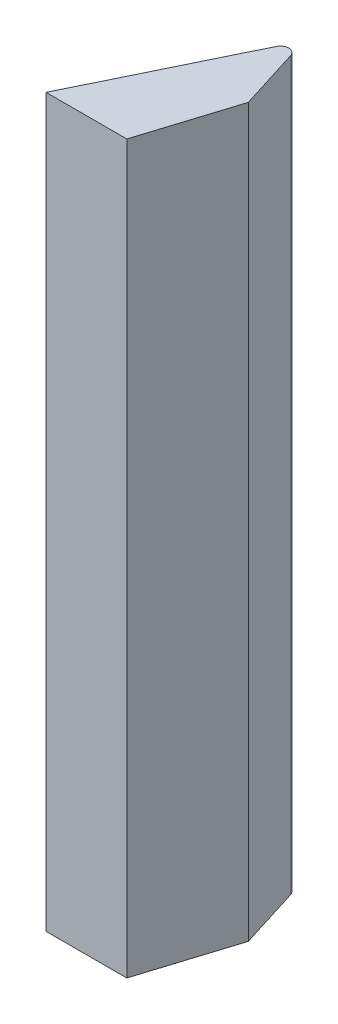
from build123d import *

# Parameters (mm, degrees)
EXTRUDE_1_DEPTH = 450


with BuildPart() as part:
    # Эскиз1 → Бобышка-Вытянуть1 (new body)
    with BuildSketch(Plane(origin=(0, 0, 0), x_dir=(1, 0, 0), z_dir=(0, 1, 0))):
        with BuildLine():
            Line((-50, 0), (0, 0))
            Line((0, 0), (17.983892853, 57.241415058))
            Line((17.983892853, 57.241415058), (6.032160279, 95.414128984))
            ThreePointArc((6.032160279, 95.414128984), (1.633797575, 98.906213149), (-3.235431405, 96.107846583))
            Line((-3.235431405, 96.107846583), (-50, 0))
        make_face()
    extrude(amount=EXTRUDE_1_DEPTH)


solid = part.part
